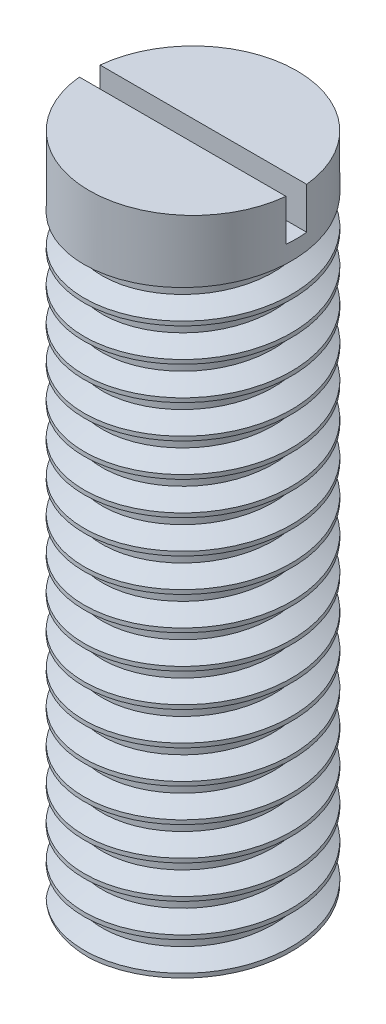
from build123d import *

# Parameters (mm, degrees)
SKETCH1_R           = 2.5
BOSS_EXTRUDE1_DEPTH = 15
THREAD1_PITCH       = 0.8
BOSS_EXTRUDE2_DEPTH = 1


with BuildPart() as part:
    # Sketch1 → Boss-Extrude1 (new body)
    with BuildSketch(Plane(origin=(0, 0, 0), x_dir=(1, 0, 0), z_dir=(0, 1, 0))):
        with Locations(Location((0, 0, 0), (0, 0, 270))):
            Circle(SKETCH1_R)
    extrude(amount=BOSS_EXTRUDE1_DEPTH)

    # Thread1: the profile of Thread Profile1 profile screwed along a right-hand helix of 18.75 turns, 8 arcs to a turn; built about Z, then put on its axis
    thread1_z = Axis((0, 0, 0), (0, 0, 1))
    thread1_corners = [(2.5003, 0, -0.000173205), (2.5003, 0, 0.700173203), (2.0669873, 0, 0.449999999), (2.0669873, 0, 0.249999999)]
    with BuildLine(mode=Mode.PRIVATE) as thread1_profile:
        Line(thread1_corners[0], thread1_corners[1])
        Line(thread1_corners[1], thread1_corners[2])
        Line(thread1_corners[2], thread1_corners[3])
        Line(thread1_corners[3], thread1_corners[0])
    thread1_cap = Face(thread1_profile.wire())
    thread1_turn_angles = [0, 22.5, 45, 67.5, 90, 112.5, 135, 157.5, 180, 202.5, 225, 247.5, 270, 292.5, 315, 337.5, 360]
    thread1_turn_weights = [1, 0.9238795325112867, 1, 0.9238795325112867, 1, 0.9238795325112867, 1, 0.9238795325112867, 1, 0.9238795325112867, 1, 0.9238795325112867, 1, 0.9238795325112867, 1, 0.9238795325112867, 1]
    thread1_turn_rails = [Edge.make_bspline([Vector(p[0], p[1], 0).rotate(thread1_z, thread1_turn_angles[k]) / thread1_turn_weights[k] + Vector(0, 0, p[2] + THREAD1_PITCH * thread1_turn_angles[k] / 360) for k in range(17)], [0, 0, 0, 1, 1, 2, 2, 3, 3, 4, 4, 5, 5, 6, 6, 7, 7, 8, 8, 8], 2, thread1_turn_weights) for p in thread1_corners]
    thread1_turn_sides = [Face.make_surface_from_curves(thread1_turn_rails[p[0]], thread1_turn_rails[p[1]]) for p in [(0, 1), (1, 2), (2, 3), (3, 0)]]
    thread1_last_angles = [6480, 6502.5, 6525, 6547.5, 6570, 6592.5, 6615, 6637.5, 6660, 6682.5, 6705, 6727.5, 6750]
    thread1_last_weights = [1, 0.9238795325112867, 1, 0.9238795325112867, 1, 0.9238795325112867, 1, 0.9238795325112867, 1, 0.9238795325112867, 1, 0.9238795325112867, 1]
    thread1_last_rails = [Edge.make_bspline([Vector(p[0], p[1], 0).rotate(thread1_z, thread1_last_angles[k]) / thread1_last_weights[k] + Vector(0, 0, p[2] + THREAD1_PITCH * thread1_last_angles[k] / 360) for k in range(13)], [0, 0, 0, 1, 1, 2, 2, 3, 3, 4, 4, 5, 5, 6, 6, 6], 2, thread1_last_weights) for p in thread1_corners]
    thread1_last_sides = [Face.make_surface_from_curves(thread1_last_rails[p[0]], thread1_last_rails[p[1]]) for p in [(0, 1), (1, 2), (2, 3), (3, 0)]]
    thread1 = Plane(origin=(0, 15, 0), x_dir=(-1, 0, 0), z_dir=(0, -1, 0)) * Solid(Shell([*[p.moved(Location((0, 0, THREAD1_PITCH * i))) for i in range(18) for p in thread1_turn_sides], *thread1_last_sides, thread1_cap, thread1_cap.rotate(thread1_z, 6750).moved(Location((0, 0, THREAD1_PITCH * 6750 / 360)))]))
    add(thread1, mode=Mode.SUBTRACT)

    # Sketch4 → Boss-Extrude2 (add)
    with BuildSketch(Plane(origin=(0, 15, 0), x_dir=(1, 0, 0), z_dir=(0, 1, 0))):
        with BuildLine():
            ThreePointArc((2.487468593, 0.25), (0, 2.5), (-2.487468593, 0.25))
            Line((-2.487468593, 0.25), (2.487468593, 0.25))
        make_face()
        with BuildLine():
            Line((2.487468593, -0.25), (-2.487468593, -0.25))
            ThreePointArc((-2.487468593, -0.25), (0, -2.5), (2.487468593, -0.25))
        make_face()
    extrude(amount=BOSS_EXTRUDE2_DEPTH)


solid = part.part
